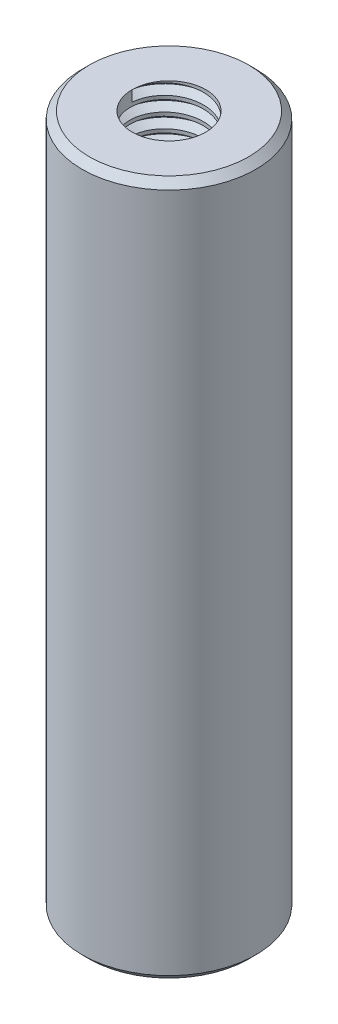
from build123d import *
from build123d.topology import SkipClean

# Parameters (mm, degrees)
CROQUIS2_R              = 4.7625
SALIENTE_EXTRUIR1_DEPTH = 19.05
CHAFL_N1_SIZE           = 0.396875
TAP_START               = 19.05
CROQUIS3_R              = 2.0193
TAP_HOLE_1_DEPTH        = 12.7
TAP_START_2             = -6.35
CROQUIS3_2_R            = 2.0193
TAP_HOLE_2_DEPTH        = 12.7
ROSCA1_PITCH            = 0.79375
ROSCA2_PITCH            = 0.79375


with BuildPart() as part:
    # Croquis2 → Saliente-Extruir1 (new, symmetric)
    with BuildSketch(Plane(origin=(0, 0, 0), x_dir=(1, 0, 0), z_dir=(0, 1, 0))):
        with Locations(Location((0, 0, 0), (0, 0, 90))):
            Circle(CROQUIS2_R)
    extrude(amount=SALIENTE_EXTRUIR1_DEPTH, both=True)

    # Chaflán1
    chafl_n1_edges = [part.edges().sort_by_distance(p)[0] for p in [
        (0, -19.05, 4.7625),
        (0, 19.05, 4.7625),
    ]]
    chamfer(chafl_n1_edges, length=CHAFL_N1_SIZE)

    # Croquis3 → Tap Hole 1 (cut)
    with BuildSketch(Plane(origin=(0, 0, 0), x_dir=(1, 0, 0), z_dir=(0, 1, 0)).offset(TAP_START)):
        with Locations(Location((0, 0, 0), (0, 0, 270))):
            Circle(CROQUIS3_R)
    extrude(amount=-TAP_HOLE_1_DEPTH, mode=Mode.SUBTRACT)

    # Croquis3<2> → Tap Hole 2 (cut)
    with BuildSketch(Plane(origin=(0, 0, 0), x_dir=(1, 0, 0), z_dir=(0, 1, 0)).offset(TAP_START_2)):
        with Locations(Location((0, 0, 0), (0, 0, 270))):
            Circle(CROQUIS3_2_R)
    extrude(amount=-TAP_HOLE_2_DEPTH, mode=Mode.SUBTRACT)

    # Rosca1: the profile of Perfil de rosca1 profile screwed along a right-hand helix of 16 turns, 8 arcs to a turn; built about Z, then put on its axis
    with SkipClean():  # the faces are left unmerged after this step: merging them gives an invalid solid
        rosca1_z = Axis((0, 0, 0), (0, 0, 1))
        rosca1_corners = [(2.019, 0, -0.000173205), (2.448929788, 0, 0.248046874), (2.448929788, 0, 0.347265624), (2.019, 0, 0.595485703)]
        with BuildLine(mode=Mode.PRIVATE) as rosca1_profile:
            Line(rosca1_corners[0], rosca1_corners[1])
            Line(rosca1_corners[1], rosca1_corners[2])
            Line(rosca1_corners[2], rosca1_corners[3])
            Line(rosca1_corners[3], rosca1_corners[0])
        rosca1_cap = Face(rosca1_profile.wire())
        rosca1_turn_angles = [0, 22.5, 45, 67.5, 90, 112.5, 135, 157.5, 180, 202.5, 225, 247.5, 270, 292.5, 315, 337.5, 360]
        rosca1_turn_weights = [1, 0.9238795325112867, 1, 0.9238795325112867, 1, 0.9238795325112867, 1, 0.9238795325112867, 1, 0.9238795325112867, 1, 0.9238795325112867, 1, 0.9238795325112867, 1, 0.9238795325112867, 1]
        rosca1_turn_rails = [Edge.make_bspline([Vector(p[0], p[1], 0).rotate(rosca1_z, rosca1_turn_angles[k]) / rosca1_turn_weights[k] + Vector(0, 0, p[2] + ROSCA1_PITCH * rosca1_turn_angles[k] / 360) for k in range(17)], [0, 0, 0, 1, 1, 2, 2, 3, 3, 4, 4, 5, 5, 6, 6, 7, 7, 8, 8, 8], 2, rosca1_turn_weights) for p in rosca1_corners]
        rosca1_turn_sides = [Face.make_surface_from_curves(rosca1_turn_rails[p[0]], rosca1_turn_rails[p[1]]) for p in [(0, 1), (1, 2), (2, 3), (3, 0)]]
        rosca1 = Plane(origin=(0, 19.05, 0), x_dir=(-1, 0, 0), z_dir=(0, -1, 0)) * Solid(Shell([*[p.moved(Location((0, 0, ROSCA1_PITCH * i))) for i in range(16) for p in rosca1_turn_sides], rosca1_cap, rosca1_cap.rotate(rosca1_z, 5760).moved(Location((0, 0, ROSCA1_PITCH * 5760 / 360)))]))
        add(rosca1, mode=Mode.SUBTRACT)

    # Rosca2: the profile of Perfil de rosca2 profile screwed along a right-hand helix of 16 turns, 8 arcs to a turn; built about Z, then put on its axis
    with SkipClean():  # the faces are left unmerged after this step: merging them gives an invalid solid
        rosca2_z = Axis((0, 0, 0), (0, 0, 1))
        rosca2_corners = [(2.019, 0, -0.000173205), (2.448929788, 0, 0.248046874), (2.448929788, 0, 0.347265624), (2.019, 0, 0.595485703)]
        with BuildLine(mode=Mode.PRIVATE) as rosca2_profile:
            Line(rosca2_corners[0], rosca2_corners[1])
            Line(rosca2_corners[1], rosca2_corners[2])
            Line(rosca2_corners[2], rosca2_corners[3])
            Line(rosca2_corners[3], rosca2_corners[0])
        rosca2_cap = Face(rosca2_profile.wire())
        rosca2_turn_angles = [0, 22.5, 45, 67.5, 90, 112.5, 135, 157.5, 180, 202.5, 225, 247.5, 270, 292.5, 315, 337.5, 360]
        rosca2_turn_weights = [1, 0.9238795325112867, 1, 0.9238795325112867, 1, 0.9238795325112867, 1, 0.9238795325112867, 1, 0.9238795325112867, 1, 0.9238795325112867, 1, 0.9238795325112867, 1, 0.9238795325112867, 1]
        rosca2_turn_rails = [Edge.make_bspline([Vector(p[0], p[1], 0).rotate(rosca2_z, rosca2_turn_angles[k]) / rosca2_turn_weights[k] + Vector(0, 0, p[2] + ROSCA2_PITCH * rosca2_turn_angles[k] / 360) for k in range(17)], [0, 0, 0, 1, 1, 2, 2, 3, 3, 4, 4, 5, 5, 6, 6, 7, 7, 8, 8, 8], 2, rosca2_turn_weights) for p in rosca2_corners]
        rosca2_turn_sides = [Face.make_surface_from_curves(rosca2_turn_rails[p[0]], rosca2_turn_rails[p[1]]) for p in [(0, 1), (1, 2), (2, 3), (3, 0)]]
        rosca2 = Plane(origin=(0, -19.05, 0), x_dir=(1, 0, 0), z_dir=(0, 1, 0)) * Solid(Shell([*[p.moved(Location((0, 0, ROSCA2_PITCH * i))) for i in range(16) for p in rosca2_turn_sides], rosca2_cap, rosca2_cap.rotate(rosca2_z, 5760).moved(Location((0, 0, ROSCA2_PITCH * 5760 / 360)))]))
        add(rosca2, mode=Mode.SUBTRACT)


solid = part.part
